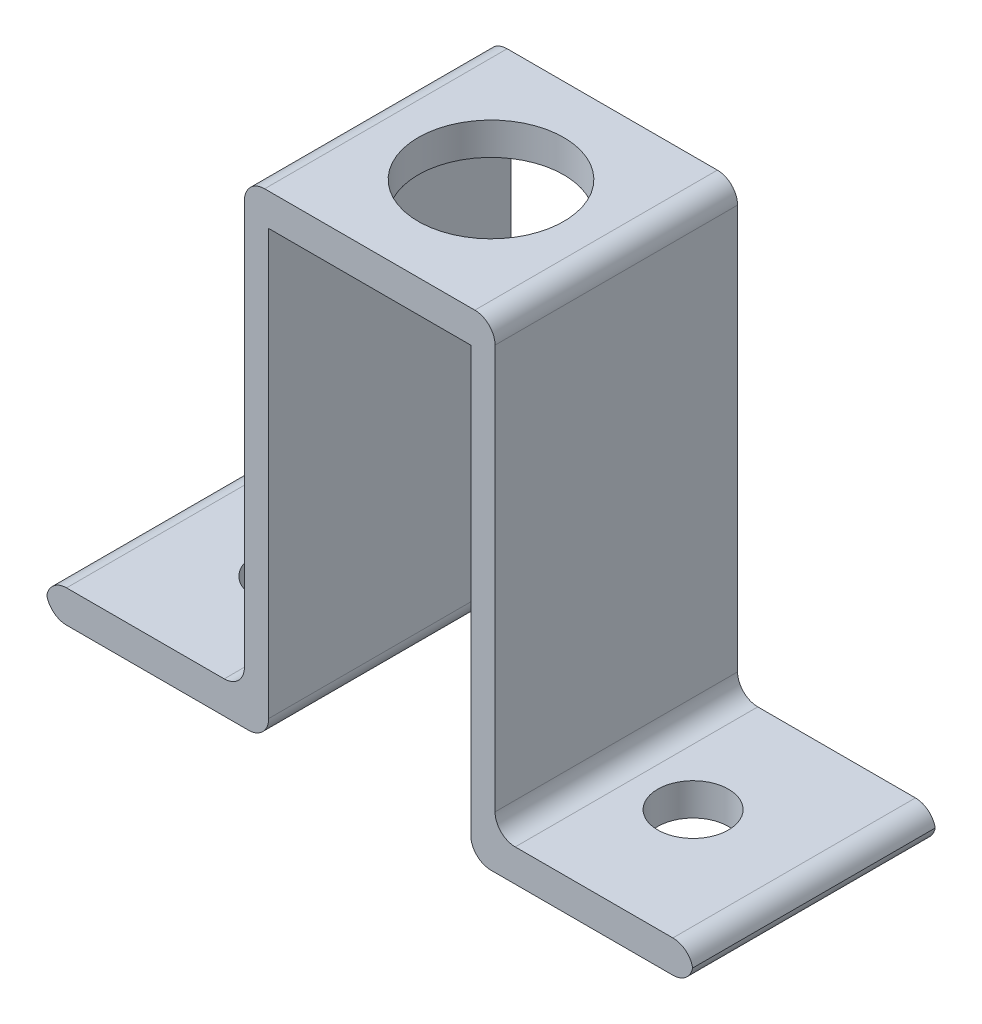
from build123d import *

# Parameters (mm, degrees)
BOSS_EXTRUDE1_DEPTH = 12
SKETCH3_R           = 3.6
CUT_EXTRUDE1_DEPTH  = 31.934770082
SKETCH5_R           = 1.75
CUT_EXTRUDE2_DEPTH  = 30.732137495
FILLET1_R           = 1


with BuildPart() as part:
    # Sketch2 → Boss-Extrude1 (new body)
    with BuildSketch(Plane.XY):
        Polygon((-5, 0), (5, 0), (5, -22), (16, -22), (16, -20.4), (6.2, -20.4), (6.2, 1.6), (-6.2, 1.6), (-6.2, -20.4), (-16, -20.4), (-16, -22), (-5, -22), align=None)
    extrude(amount=BOSS_EXTRUDE1_DEPTH)

    # Sketch3 → Cut-Extrude1 (cut, through all)
    with BuildSketch(Plane(origin=(0, 1.6, 0), x_dir=(1, 0, 0), z_dir=(0, 1, 0))):
        with Locations(Location((0, -6, 0), (0, 0, 180))):
            Circle(SKETCH3_R)
    extrude(amount=-CUT_EXTRUDE1_DEPTH, mode=Mode.SUBTRACT)

    # Sketch5 → Cut-Extrude2 (cut, through all)
    with BuildSketch(Plane(origin=(0, -20.4, 0), x_dir=(1, 0, 0), z_dir=(0, 1, 0))):
        with Locations(Location((-10, -6, 0), (0, 0, 180))):
            Circle(SKETCH5_R)
        with Locations(Location((10, -6, 0), (0, 0, 180))):
            Circle(SKETCH5_R)
    extrude(amount=-CUT_EXTRUDE2_DEPTH, mode=Mode.SUBTRACT)

    # Fillet1
    # the kernel refuses this fillet: 1 mm, written as the material it adds along each edge
    with BuildSketch(Plane(origin=(-6.2, -20.4, 0), x_dir=(0, 1, 0), z_dir=(0, 0, 1)), Plane(origin=(6.2, -20.4, 0), x_dir=(1, 0, 0), z_dir=(0, 0, 1))) as fillet1_piece_1:
        with BuildLine():
            CenterArc((FILLET1_R, FILLET1_R), FILLET1_R, 180, 90)
            Line((0, FILLET1_R), (0, 0))
            Line((0, 0), (FILLET1_R, 0))
        make_face()
    extrude(amount=12)
    # the kernel refuses this fillet: 1 mm, written as the material it takes off along each edge
    with BuildSketch(Plane(origin=(16, -20.4, -2.5), x_dir=(0, -1, 0), z_dir=(0, 0, 1)), Plane(origin=(16, -22, -2.5), x_dir=(-1, 0, 0), z_dir=(0, 0, 1)), Plane(origin=(-16, -20.4, -2.5), x_dir=(1, 0, 0), z_dir=(0, 0, 1)), Plane(origin=(-6.2, 1.6, -2.5), x_dir=(1, 0, 0), z_dir=(0, 0, 1)), Plane(origin=(6.2, 1.6, -2.5), x_dir=(0, -1, 0), z_dir=(0, 0, 1)), Plane(origin=(5, -22, -2.5), x_dir=(0, 1, 0), z_dir=(0, 0, 1))) as fillet1_2_piece_1:
        with BuildLine():
            CenterArc((FILLET1_R, -FILLET1_R), FILLET1_R, 90, 90)
            Line((0, -FILLET1_R), (0, 0))
            Line((0, 0), (FILLET1_R, 0))
        make_face()
    extrude(amount=17, mode=Mode.SUBTRACT)
    with BuildSketch(Plane(origin=(-16, -22, -2.5), x_dir=(1, 0, 0), z_dir=(0, 0, 1)), Plane(origin=(-5, -22, -2.5), x_dir=(0, 1, 0), z_dir=(0, 0, 1))) as fillet1_2_piece_2:
        with BuildLine():
            CenterArc((FILLET1_R, FILLET1_R), FILLET1_R, 180, 90)
            Line((0, FILLET1_R), (0, 0))
            Line((0, 0), (FILLET1_R, 0))
        make_face()
    extrude(amount=17, mode=Mode.SUBTRACT)


solid = part.part
